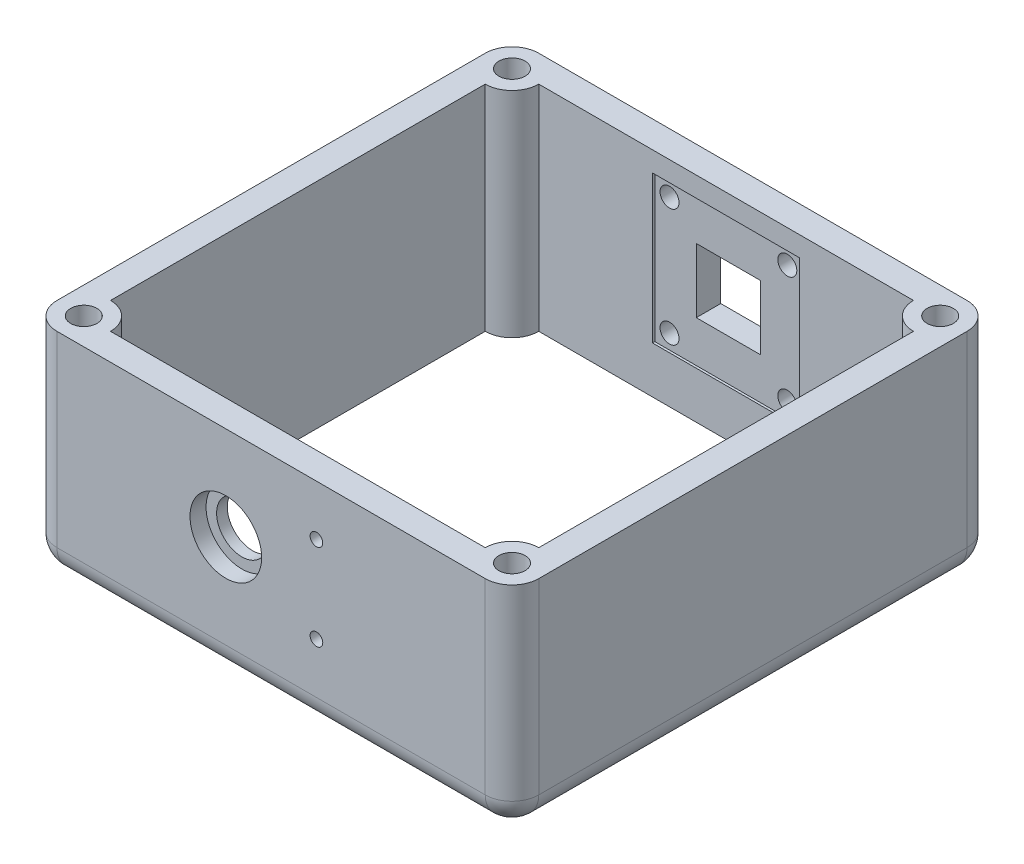
from build123d import *

# Parameters (mm, degrees)
SKETCH1_W                                           = 114.3
SKETCH1_H                                           = 114.3
BOSS_EXTRUDE1_DEPTH                                 = 25.4
CUT_EXTRUDE1_DEPTH                                  = 50.8
CBORE_FOR_0_BINDING_HEAD_MACHINE_SCREW1_D           = 1.8542
CBORE_FOR_0_BINDING_HEAD_MACHINE_SCREW1_DEPTH       = 17.73094212
CBORE_FOR_0_BINDING_HEAD_MACHINE_SCREW1_CBORE_D     = 6.223
CBORE_FOR_0_BINDING_HEAD_MACHINE_SCREW1_CBORE_DEPTH = 9.144
CBORE_FOR_0_BINDING_HEAD_MACHINE_SCREW1_TIP         = 0.55705788
SKETCH5_W                                           = 34.94
SKETCH5_H                                           = 34.94
SKETCH5_W_2                                         = 15.25
SKETCH5_H_2                                         = 15.25
CUT_EXTRUDE5_DEPTH                                  = 0.55
CUT_EXTRUDE6_REACH                                  = 126.758
SKETCH5_3_W                                         = 15.25
SKETCH5_3_H                                         = 15.25
SKETCH13_R                                          = 2.54
BOSS_EXTRUDE2_DEPTH                                 = 1.27
CUT_EXTRUDE7_DEPTH                                  = 2.54
CUT_EXTRUDE8_DEPTH                                  = 0.635
CUT_EXTRUDE9_DEPTH                                  = 1.27
CBORE_FOR_M5_HEX_HEAD_BOLT2_AT_2_COUNT              = 2
CBORE_FOR_M5_HEX_HEAD_BOLT2_AT_2_PITCH              = 27.94
CBORE_FOR_M5_HEX_HEAD_BOLT2_AT_3_COUNT              = 2
CBORE_FOR_M5_HEX_HEAD_BOLT2_AT_3_PITCH              = 39.513126933
CBORE_FOR_M5_HEX_HEAD_BOLT2_AT_4_COUNT              = 2
CBORE_FOR_M5_HEX_HEAD_BOLT2_AT_4_PITCH              = 27.94
CUT_EXTRUDE10_START                                 = -2.032
CUT_EXTRUDE10_DEPTH                                 = 2.032
CIRPATTERN1_COUNT                                   = 4
FILLET1_R                                           = 6.35
SKETCH24_R                                          = 8.5
SKETCH24_R_2                                        = 6
CUT_EXTRUDE11_DEPTH                                 = 3.81
CUT_EXTRUDE12_REACH                                 = 134.525
SKETCH24_3_R                                        = 6
SKETCH24_3_R_2                                      = 1.5
BOSS_EXTRUDE3_DEPTH                                 = 2.8


with BuildPart() as part:
    # Sketch1 → Boss-Extrude1 (new, symmetric)
    with BuildSketch(Plane(origin=(0, 0, 0), x_dir=(1, 0, 0), z_dir=(0, 1, 0))):
        Rectangle(SKETCH1_W, SKETCH1_H)
    extrude(amount=BOSS_EXTRUDE1_DEPTH, both=True)

    # Sketch2 → Cut-Extrude1 (cut)
    with BuildSketch(Plane(origin=(0, 25.4, 0), x_dir=(1, 0, 0), z_dir=(0, 1, 0))):
        with BuildLine():
            Line((44.45, 50.8), (-44.45, 50.8))
            ThreePointArc((-44.45, 50.8), (-46.309871939, 46.309871939), (-50.8, 44.45))
            Line((-50.8, 44.45), (-50.8, -44.45))
            ThreePointArc((-50.8, -44.45), (-46.309871939, -46.309871939), (-44.45, -50.8))
            Line((-44.45, -50.8), (44.45, -50.8))
            ThreePointArc((44.45, -50.8), (46.309871939, -46.309871939), (50.8, -44.45))
            Line((50.8, -44.45), (50.8, 44.45))
            ThreePointArc((50.8, 44.45), (46.309871939, 46.309871939), (44.45, 50.8))
        make_face()
    extrude(amount=-CUT_EXTRUDE1_DEPTH, mode=Mode.SUBTRACT)

    # CBORE for #0 Binding Head Machine Screw1
    with Locations(Plane(origin=(-50.8, 25.4, -50.8), x_dir=(0, 0, 1), z_dir=(0, 1, 0))):
        with Locations((0, 0), (0, 101.6), (101.6, 0), (101.6, 101.6)):
            CounterBoreHole(CBORE_FOR_0_BINDING_HEAD_MACHINE_SCREW1_D / 2, CBORE_FOR_0_BINDING_HEAD_MACHINE_SCREW1_CBORE_D / 2, CBORE_FOR_0_BINDING_HEAD_MACHINE_SCREW1_CBORE_DEPTH, depth=CBORE_FOR_0_BINDING_HEAD_MACHINE_SCREW1_DEPTH)
            with Locations((0, 0, -(CBORE_FOR_0_BINDING_HEAD_MACHINE_SCREW1_DEPTH + CBORE_FOR_0_BINDING_HEAD_MACHINE_SCREW1_TIP / 2))):  # 118° drill point
                Cone(0, CBORE_FOR_0_BINDING_HEAD_MACHINE_SCREW1_D / 2, CBORE_FOR_0_BINDING_HEAD_MACHINE_SCREW1_TIP, mode=Mode.SUBTRACT)

    # Sketch5 → Cut-Extrude5 (cut)
    with BuildSketch(Plane.XY.offset(-50.8)):
        with Locations((0, 3.175)):
            Rectangle(SKETCH5_W, SKETCH5_H)
        with Locations((0, 3.175)):
            Rectangle(SKETCH5_W_2, SKETCH5_H_2, mode=Mode.SUBTRACT)
    extrude(amount=-CUT_EXTRUDE5_DEPTH, mode=Mode.SUBTRACT)

    # Sketch5<3> → Cut-Extrude6 (cut, up to next)
    with BuildSketch(Plane.XY.offset(-50.8), mode=Mode.PRIVATE) as cut_extrude6_sk1:
        with Locations((0, 3.175)):
            Rectangle(SKETCH5_3_W, SKETCH5_3_H)
    cut_extrude6_tool1 = extrude(cut_extrude6_sk1.sketch, amount=-CUT_EXTRUDE6_REACH, mode=Mode.PRIVATE) & part.part
    add(cut_extrude6_tool1.solids().sort_by_distance((0, 3.175, -50.8))[0], mode=Mode.SUBTRACT)

    # Sketch13 → Boss-Extrude2 (add)
    with BuildSketch(Plane(origin=(0, 0, -57.15), x_dir=(-1, 0, 0), z_dir=(0, 0, -1))):
        with Locations(Location((-14.2875, -3.175, 0), (0, 0, 180))):
            Circle(SKETCH13_R)
    boss_extrude2 = extrude(amount=BOSS_EXTRUDE2_DEPTH)

    # Sketch14 → Revolve1 (revolve)
    with BuildSketch(Plane(origin=(14.2875, -3.175, -57.15), x_dir=(-1, 0, 0), z_dir=(0, -1, 0)), mode=Mode.PRIVATE) as revolve1_sk:
        Polygon((0, 1.27), (0, 2.54), (2.286, 2.54), (2.64, 1.905), (2.64, 1.27), (2.54, 1.27), align=None)
    revolve1 = revolve(revolve1_sk.sketch.rotate(Axis((14.2875, -3.175, -58.42), (0, 0, -1)), 180), axis=Axis((14.2875, -3.175, -58.42), (0, 0, -1)))

    # Sketch13<4> → Cut-Extrude7 (cut)
    with BuildSketch(Plane(origin=(0, 0, -57.15), x_dir=(-1, 0, 0), z_dir=(0, 0, -1))):
        with BuildLine():
            Line((16.083551224, -1.378948776), (14.7875, -2.675))
            Line((14.7875, -2.675), (14.7875, -3.675))
            Line((14.7875, -3.675), (16.083551224, -4.971051224))
            ThreePointArc((16.083551224, -4.971051224), (16.634154013, -4.147015918), (16.8275, -3.175))
            ThreePointArc((16.8275, -3.175), (16.634154013, -2.202984082), (16.083551224, -1.378948776))
        make_face()
        with BuildLine():
            Line((16.083551224, -4.971051224), (14.7875, -3.675))
            Line((14.7875, -3.675), (14.7875, -5.665301187))
            ThreePointArc((14.7875, -5.665301187), (15.486857561, -5.414004565), (16.083551224, -4.971051224))
        make_face()
        with BuildLine():
            ThreePointArc((14.7875, -0.684698813), (14.2875, -0.635), (13.7875, -0.684698813))
            Line((13.7875, -0.684698813), (13.7875, -2.675))
            Line((13.7875, -2.675), (14.2875, -3.175))
            Line((14.2875, -3.175), (14.7875, -2.675))
            Line((14.7875, -2.675), (14.7875, -0.684698813))
        make_face()
        with BuildLine():
            Line((14.2875, -3.175), (13.7875, -3.675))
            Line((13.7875, -3.675), (13.7875, -5.665301187))
            ThreePointArc((13.7875, -5.665301187), (14.2875, -5.715), (14.7875, -5.665301187))
            Line((14.7875, -5.665301187), (14.7875, -3.675))
            Line((14.7875, -3.675), (14.2875, -3.175))
        make_face()
        with BuildLine():
            ThreePointArc((16.083551224, -1.378948776), (15.486857561, -0.935995435), (14.7875, -0.684698813))
            Line((14.7875, -0.684698813), (14.7875, -2.675))
            Line((14.7875, -2.675), (16.083551224, -1.378948776))
        make_face()
        Polygon((14.7875, -2.675), (14.2875, -3.175), (14.7875, -3.675), align=None)
        Polygon((14.2875, -3.175), (13.7875, -2.675), (13.7875, -3.675), align=None)
        with BuildLine():
            Line((13.7875, -3.675), (13.7875, -2.675))
            Line((13.7875, -2.675), (12.491448776, -1.378948776))
            ThreePointArc((12.491448776, -1.378948776), (11.7475, -3.175), (12.491448776, -4.971051224))
            Line((12.491448776, -4.971051224), (13.7875, -3.675))
        make_face()
        with BuildLine():
            Line((13.7875, -5.665301187), (13.7875, -3.675))
            Line((13.7875, -3.675), (12.491448776, -4.971051224))
            ThreePointArc((12.491448776, -4.971051224), (13.088142439, -5.414004565), (13.7875, -5.665301187))
        make_face()
        with BuildLine():
            Line((13.7875, -2.675), (13.7875, -0.684698813))
            ThreePointArc((13.7875, -0.684698813), (13.088142439, -0.935995435), (12.491448776, -1.378948776))
            Line((12.491448776, -1.378948776), (13.7875, -2.675))
        make_face()
    cut_extrude7 = extrude(amount=-CUT_EXTRUDE7_DEPTH, mode=Mode.SUBTRACT)

    # Sketch13<5> → Cut-Extrude8 (cut)
    with BuildSketch(Plane(origin=(0, 0, -57.15), x_dir=(-1, 0, 0), z_dir=(0, 0, -1))):
        with BuildLine():
            Line((12.491448776, -4.971051224), (11.593423164, -5.869076836))
            ThreePointArc((11.593423164, -5.869076836), (12.601161082, -6.591483726), (13.7875, -6.952049113))
            Line((13.7875, -6.952049113), (13.7875, -5.665301187))
            ThreePointArc((13.7875, -5.665301187), (13.088142439, -5.414004565), (12.491448776, -4.971051224))
        make_face()
        with BuildLine():
            ThreePointArc((14.7875, -6.952049113), (15.973838918, -6.591483726), (16.981576836, -5.869076836))
            Line((16.981576836, -5.869076836), (16.083551224, -4.971051224))
            ThreePointArc((16.083551224, -4.971051224), (15.486857561, -5.414004565), (14.7875, -5.665301187))
            Line((14.7875, -5.665301187), (14.7875, -6.952049113))
        make_face()
        with BuildLine():
            ThreePointArc((16.981576836, -0.480923164), (15.973838918, 0.241483726), (14.7875, 0.602049113))
            Line((14.7875, 0.602049113), (14.7875, -0.684698813))
            ThreePointArc((14.7875, -0.684698813), (15.486857561, -0.935995435), (16.083551224, -1.378948776))
            Line((16.083551224, -1.378948776), (16.981576836, -0.480923164))
        make_face()
        with BuildLine():
            Line((13.7875, -0.684698813), (13.7875, 0.602049113))
            ThreePointArc((13.7875, 0.602049113), (12.601161082, 0.241483726), (11.593423164, -0.480923164))
            Line((11.593423164, -0.480923164), (12.491448776, -1.378948776))
            ThreePointArc((12.491448776, -1.378948776), (13.088142439, -0.935995435), (13.7875, -0.684698813))
        make_face()
    cut_extrude8 = extrude(amount=-CUT_EXTRUDE8_DEPTH, mode=Mode.SUBTRACT)

    # Sketch13<6> → Cut-Extrude9 (cut)
    with BuildSketch(Plane(origin=(0, 0, -57.15), x_dir=(-1, 0, 0), z_dir=(0, 0, -1))):
        with BuildLine():
            ThreePointArc((14.7875, 0.602049113), (14.2875, 0.635), (13.7875, 0.602049113))
            Line((13.7875, 0.602049113), (13.7875, -0.684698813))
            ThreePointArc((13.7875, -0.684698813), (14.2875, -0.635), (14.7875, -0.684698813))
            Line((14.7875, -0.684698813), (14.7875, 0.602049113))
        make_face()
        with BuildLine():
            Line((13.7875, -5.665301187), (13.7875, -6.952049113))
            ThreePointArc((13.7875, -6.952049113), (14.2875, -6.985), (14.7875, -6.952049113))
            Line((14.7875, -6.952049113), (14.7875, -5.665301187))
            ThreePointArc((14.7875, -5.665301187), (14.2875, -5.715), (13.7875, -5.665301187))
        make_face()
    cut_extrude9 = extrude(amount=-CUT_EXTRUDE9_DEPTH, mode=Mode.SUBTRACT)

    # Sketch17 → Cut-Revolve1 (revolve, cut)
    with BuildSketch(Plane(origin=(-14.2875, -3.175, -57.15), x_dir=(-1, 0, 0), z_dir=(0, -1, 0))):
        Polygon((0, -1.27), (0, -2.54), (2.286, -2.54), (2.64, -1.905), (2.64, -1.27), (2.54, -1.27), align=None)
    cut_revolve1 = revolve(axis=Axis((-14.2875, -3.175, -55.88), (0, 0, 1)), mode=Mode.SUBTRACT)

    # Sketch21 → CBORE for M5 Hex Head Bolt2 (revolve, cut)
    with BuildSketch(Plane(origin=(13.97, 17.145, -57.15), x_dir=(0, 1, 0), z_dir=(1, 0, 0))):
        Polygon((0, 0), (0, 18.288), (2.75, 16.635633298), (2.75, 5.8), (2.25, 5.8), (2.25, 0), align=None)
    cbore_for_m5_hex_head_bolt2 = revolve(axis=Axis((13.97, 17.145, -63.5), (0, 0, 1)), mode=Mode.SUBTRACT)

    # CBORE for M5 Hex Head Bolt2 at 2: CBORE for M5 Hex Head Bolt2 ×2
    with Locations(*[(-i * CBORE_FOR_M5_HEX_HEAD_BOLT2_AT_2_PITCH, 0, 0) for i in range(1, CBORE_FOR_M5_HEX_HEAD_BOLT2_AT_2_COUNT)]):
        add(cbore_for_m5_hex_head_bolt2, mode=Mode.SUBTRACT)

    # CBORE for M5 Hex Head Bolt2 at 3: CBORE for M5 Hex Head Bolt2 ×2
    with Locations(*[Vector(-0.7071067811865476, -0.7071067811865476, 0) * (i * CBORE_FOR_M5_HEX_HEAD_BOLT2_AT_3_PITCH) for i in range(1, CBORE_FOR_M5_HEX_HEAD_BOLT2_AT_3_COUNT)]):
        add(cbore_for_m5_hex_head_bolt2, mode=Mode.SUBTRACT)

    # CBORE for M5 Hex Head Bolt2 at 4: CBORE for M5 Hex Head Bolt2 ×2
    with Locations(*[(0, -i * CBORE_FOR_M5_HEX_HEAD_BOLT2_AT_4_PITCH, 0) for i in range(1, CBORE_FOR_M5_HEX_HEAD_BOLT2_AT_4_COUNT)]):
        add(cbore_for_m5_hex_head_bolt2, mode=Mode.SUBTRACT)

    # Sketch23 → Cut-Extrude10 (cut)
    with BuildSketch(Plane(origin=(0, 0, -59.69), x_dir=(-1, 0, 0), z_dir=(0, 0, -1)).offset(CUT_EXTRUDE10_START)):
        with BuildLine():
            ThreePointArc((-14.2875, -0.889), (-14.539027189, -0.902879829), (-14.7875, -0.944350767))
            Line((-14.7875, -0.944350767), (-14.7875, -5.405649233))
            ThreePointArc((-14.7875, -5.405649233), (-14.539027189, -5.447120171), (-14.2875, -5.461))
            Line((-14.2875, -5.461), (-14.2875, -0.889))
        make_face()
        with BuildLine():
            ThreePointArc((-13.7875, -0.944350767), (-14.035972811, -0.902879829), (-14.2875, -0.889))
            Line((-14.2875, -0.889), (-14.2875, -5.461))
            ThreePointArc((-14.2875, -5.461), (-14.035972811, -5.447120171), (-13.7875, -5.405649233))
            Line((-13.7875, -5.405649233), (-13.7875, -0.944350767))
        make_face()
        with BuildLine():
            ThreePointArc((-14.2875, -0.535), (-14.538638912, -0.546972366), (-14.7875, -0.582780873))
            Line((-14.7875, -0.582780873), (-14.7875, -0.944350767))
            ThreePointArc((-14.7875, -0.944350767), (-14.539027189, -0.902879829), (-14.2875, -0.889))
            Line((-14.2875, -0.889), (-14.2875, -0.535))
        make_face()
        with BuildLine():
            Line((-14.7875, -5.405649233), (-14.7875, -5.767219127))
            ThreePointArc((-14.7875, -5.767219127), (-14.538638912, -5.803027634), (-14.2875, -5.815))
            Line((-14.2875, -5.815), (-14.2875, -5.461))
            ThreePointArc((-14.2875, -5.461), (-14.539027189, -5.447120171), (-14.7875, -5.405649233))
        make_face()
        with BuildLine():
            ThreePointArc((-13.7875, -0.582780873), (-14.036361088, -0.546972366), (-14.2875, -0.535))
            Line((-14.2875, -0.535), (-14.2875, -0.889))
            ThreePointArc((-14.2875, -0.889), (-14.035972811, -0.902879829), (-13.7875, -0.944350767))
            Line((-13.7875, -0.944350767), (-13.7875, -0.582780873))
        make_face()
        with BuildLine():
            Line((-14.2875, -5.461), (-14.2875, -5.815))
            ThreePointArc((-14.2875, -5.815), (-14.036361088, -5.803027634), (-13.7875, -5.767219127))
            Line((-13.7875, -5.767219127), (-13.7875, -5.405649233))
            ThreePointArc((-13.7875, -5.405649233), (-14.035972811, -5.447120171), (-14.2875, -5.461))
        make_face()
    cut_extrude10 = extrude(amount=CUT_EXTRUDE10_DEPTH, mode=Mode.SUBTRACT)

    # CirPattern1: Boss-Extrude2, Revolve1, Cut-Extrude7, Cut-Extrude8, Cut-Extrude9, Cut-Revolve1, Cut-Extrude10 ×4 about axis
    cirpattern1_axis = Axis((0, 3.175, 0), (0, 0, 1))
    add([boss_extrude2.rotate(cirpattern1_axis, i * 360 / CIRPATTERN1_COUNT) for i in range(1, CIRPATTERN1_COUNT)])
    add([revolve1.rotate(cirpattern1_axis, i * 360 / CIRPATTERN1_COUNT) for i in range(1, CIRPATTERN1_COUNT)])
    add([cut_extrude7.rotate(cirpattern1_axis, i * 360 / CIRPATTERN1_COUNT) for i in range(1, CIRPATTERN1_COUNT)], mode=Mode.SUBTRACT)
    add([cut_extrude8.rotate(cirpattern1_axis, i * 360 / CIRPATTERN1_COUNT) for i in range(1, CIRPATTERN1_COUNT)], mode=Mode.SUBTRACT)
    add([cut_extrude9.rotate(cirpattern1_axis, i * 360 / CIRPATTERN1_COUNT) for i in range(1, CIRPATTERN1_COUNT)], mode=Mode.SUBTRACT)
    add([cut_revolve1.rotate(cirpattern1_axis, i * 360 / CIRPATTERN1_COUNT) for i in range(1, CIRPATTERN1_COUNT)], mode=Mode.SUBTRACT)
    add([cut_extrude10.rotate(cirpattern1_axis, i * 360 / CIRPATTERN1_COUNT) for i in range(1, CIRPATTERN1_COUNT)], mode=Mode.SUBTRACT)

    # Fillet1
    fillet1_edges = [part.edges().sort_by_distance(p)[0] for p in [
        (0, -25.4, -57.15),
        (57.15, -25.4, 0),
        (0, -25.4, 57.15),
        (-57.15, -25.4, 0),
        (-57.15, 0, -57.15),
        (57.15, 0, -57.15),
        (57.15, 0, 57.15),
        (-57.15, 0, 57.15),
    ]]
    fillet(fillet1_edges, radius=FILLET1_R - 0.0001)  # a hair under: the kernel refuses the full size

    # Sketch24 → Cut-Extrude11 (cut)
    with BuildSketch(Plane.XY.offset(57.15)):
        with Locations((-10.75, 3.175)):
            Circle(SKETCH24_R)
        with Locations((-10.75, 3.175)):
            Circle(SKETCH24_R_2, mode=Mode.SUBTRACT)
    extrude(amount=-CUT_EXTRUDE11_DEPTH, mode=Mode.SUBTRACT)

    # Sketch24<3> → Cut-Extrude12 (cut, up to next)
    with BuildSketch(Plane.XY.offset(57.15), mode=Mode.PRIVATE) as cut_extrude12_sk1:
        with Locations((-10.75, 3.175)):
            Circle(SKETCH24_3_R)
    cut_extrude12_tool1 = extrude(cut_extrude12_sk1.sketch, amount=-CUT_EXTRUDE12_REACH, mode=Mode.PRIVATE) & part.part
    # Sketch24<3> → Cut-Extrude12 (cut, up to next)
    with BuildSketch(Plane.XY.offset(57.15), mode=Mode.PRIVATE) as cut_extrude12_sk2:
        with Locations((10.75, 13.425)):
            Circle(SKETCH24_3_R_2)
    cut_extrude12_tool2 = extrude(cut_extrude12_sk2.sketch, amount=-CUT_EXTRUDE12_REACH, mode=Mode.PRIVATE) & part.part
    # Sketch24<3> → Cut-Extrude12 (cut, up to next)
    with BuildSketch(Plane.XY.offset(57.15), mode=Mode.PRIVATE) as cut_extrude12_sk3:
        with Locations((10.75, -7.075)):
            Circle(SKETCH24_3_R_2)
    cut_extrude12_tool3 = extrude(cut_extrude12_sk3.sketch, amount=-CUT_EXTRUDE12_REACH, mode=Mode.PRIVATE) & part.part
    add(cut_extrude12_tool1.solids().sort_by_distance((-10.75, 3.175, 57.15))[0], mode=Mode.SUBTRACT)
    add(cut_extrude12_tool2.solids().sort_by_distance((10.75, 13.425, 57.15))[0], mode=Mode.SUBTRACT)
    add(cut_extrude12_tool3.solids().sort_by_distance((10.75, -7.075, 57.15))[0], mode=Mode.SUBTRACT)

    # Sketch25 → Boss-Extrude3 (add)
    with BuildSketch(Plane(origin=(0, 0, 50.8), x_dir=(-1, 0, 0), z_dir=(0, 0, -1))):
        with BuildLine():
            ThreePointArc((-17.210323757, 6.619515112), (-16.506337829, 6.325365544), (-15.75, 6.225))
            ThreePointArc((-15.75, 6.225), (-14.993662171, 6.325365544), (-14.289676243, 6.619515112))
            Line((-14.289676243, 6.619515112), (-14.289676243, 11.630484888))
            ThreePointArc((-14.289676243, 11.630484888), (-15.75, 12.025), (-17.210323757, 11.630484888))
            Line((-17.210323757, 11.630484888), (-17.210323757, 6.619515112))
        make_face()
        with BuildLine():
            ThreePointArc((-14.289676243, -0.269515112), (-14.993662171, 0.024634456), (-15.75, 0.125))
            ThreePointArc((-15.75, 0.125), (-16.506337829, 0.024634456), (-17.210323757, -0.269515112))
            Line((-17.210323757, -0.269515112), (-17.210323757, -5.280484888))
            ThreePointArc((-17.210323757, -5.280484888), (-15.75, -5.675), (-14.289676243, -5.280484888))
            Line((-14.289676243, -5.280484888), (-14.289676243, -0.269515112))
        make_face()
    extrude(amount=BOSS_EXTRUDE3_DEPTH)


solid = part.part
